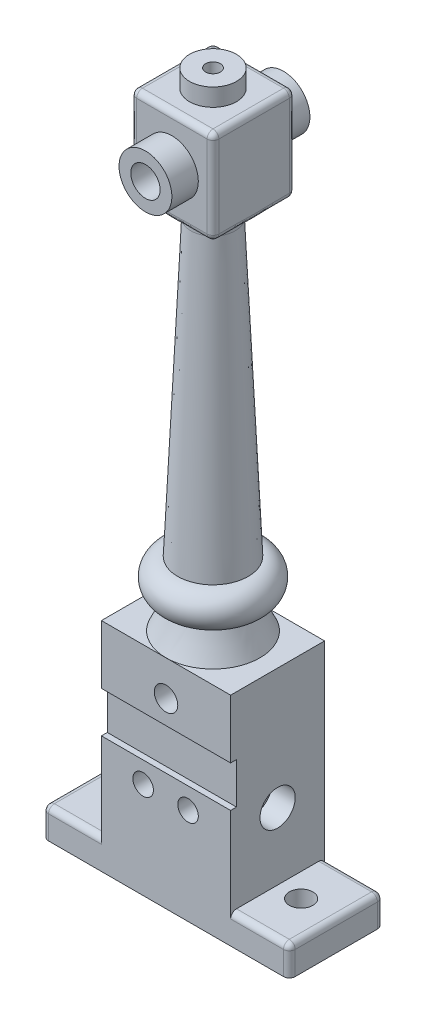
from build123d import *

# Parameters (mm, degrees)
SKETCH1_R                               = 2
BOSS_EXTRUDE1_DEPTH                     = 8
SKETCH2_W                               = 1
SKETCH2_H                               = 7
CUT_EXTRUDE1_DEPTH                      = 50.568134926
CBORE_FOR_M6_HEX_HEAD_BOLT3_D           = 3.5
CBORE_FOR_M6_HEX_HEAD_BOLT3_DEPTH       = 9
CBORE_FOR_M6_HEX_HEAD_BOLT3_CBORE_D     = 6
CBORE_FOR_M6_HEX_HEAD_BOLT3_CBORE_DEPTH = 4
SKETCH29_R                              = 1.75
CUT_EXTRUDE4_DEPTH                      = 23.5
SKETCH50_W                              = 14
SKETCH50_H                              = 14
BOSS_EXTRUDE3_DEPTH                     = 16
FILLET2_R                               = 3
BOSS_EXTRUDE4_DEPTH                     = 4.5
BOSS_EXTRUDE4_DEPTH_BACK                = 19
SKETCH52_R                              = 4.5
SKETCH54_R                              = 4
BOSS_EXTRUDE5_DEPTH                     = 3
CUT_EXTRUDE5_DEPTH                      = 125.069536954
CUT_EXTRUDE5_DEPTH_BACK                 = 125.069536954
SKETCH55_R                              = 2.5
CUT_EXTRUDE6_REACH                      = 124.413
SKETCH56_R                              = 1.25
CUT_EXTRUDE6_DIRECTION_2_DEPTH          = 123.413234579
FILLET5_R                               = 1
FILLET8_R                               = 1
SKETCH57_R                              = 2
CUT_EXTRUDE7_DEPTH                      = 118.515956471


with BuildPart() as part:
    # Sketch1 → Boss-Extrude1 (new, symmetric)
    with BuildSketch(Plane.XY):
        Polygon((-21, 0), (21, 0), (21, 5), (11, 5), (11, 37), (-11, 37), (-11, 5), (-21, 5), align=None)
        with Locations((0, 31)):
            Circle(SKETCH1_R, mode=Mode.SUBTRACT)
    extrude(amount=BOSS_EXTRUDE1_DEPTH, both=True)

    # Sketch2 → Cut-Extrude1 (cut, through all)
    with BuildSketch(Plane(origin=(11, 0, 0), x_dir=(0, 0, -1), z_dir=(1, 0, 0))):
        with Locations((-7.5, 23.5)):
            Rectangle(SKETCH2_W, SKETCH2_H)
    extrude(amount=-CUT_EXTRUDE1_DEPTH, mode=Mode.SUBTRACT)

    # CBORE for M6 Hex Head Bolt3
    with Locations(Plane(origin=(11, 0, 0), x_dir=(0, 0, -1), z_dir=(1, 0, 0))):
        with Locations((0, 16.4)):
            cbore_for_m6_hex_head_bolt3 = CounterBoreHole(CBORE_FOR_M6_HEX_HEAD_BOLT3_D / 2, CBORE_FOR_M6_HEX_HEAD_BOLT3_CBORE_D / 2, CBORE_FOR_M6_HEX_HEAD_BOLT3_CBORE_DEPTH, depth=CBORE_FOR_M6_HEX_HEAD_BOLT3_DEPTH)

    # Mirror1: CBORE for M6 Hex Head Bolt3 across plane
    add(cbore_for_m6_hex_head_bolt3.mirror(Plane(origin=(0, 0, 0), x_dir=(0, 0, 1), z_dir=(1, 0, 0))), mode=Mode.SUBTRACT)

    # Sketch29 → Cut-Extrude4 (cut)
    with BuildSketch(Plane.XY.offset(8)):
        with Locations((3.75, 16.4)):
            Circle(SKETCH29_R)
        with Locations((-3.895843616, 16.4)):
            Circle(SKETCH29_R)
    extrude(amount=-CUT_EXTRUDE4_DEPTH, mode=Mode.SUBTRACT)

    # Loft4: read off the stored shape, not the designer's step
    # Loft4: loft between two sections, ruled curve by curve
    loft4_from = [
        Edge.make_bspline([(7.297418747, 37, 3.278365391), (13.854149528, 37, -11.316472103), (-0.740687965, 37, -17.873202884), (-7.297418747, 37, -3.278365391), (-13.854149528, 37, 11.316472103), (0.740687965, 37, 17.873202884), (7.297418747, 37, 3.278365391)], [0, 0, 0, 0, 0.5, 0.5, 0.5, 1, 1, 1, 1], 3, [1, 0.333333333, 0.333333333, 1, 0.333333333, 0.333333333, 1]),
    ]
    loft4_to = [
        Edge.make_bspline([(5.968944679, 42, 0.609671566), (7.18828781, 42, -11.328217793), (-4.749601548, 42, -12.547560924), (-5.968944679, 42, -0.609671566), (-7.18828781, 42, 11.328217793), (4.749601548, 42, 12.547560924), (5.968944679, 42, 0.609671566)], [0, 0, 0, 0, 0.5, 0.5, 0.5, 1, 1, 1, 1], 3, [1, 0.333333333, 0.333333333, 1, 0.333333333, 0.333333333, 1]),
    ]
    loft4 = Solid(Shell([*[Face.make_surface_from_curves(loft4_from[k], loft4_to[k]) for k in range(1)], Face(Wire(loft4_from)), Face(Wire(loft4_to))]))
    add(loft4)

    # Sketch36 → Revolve1 (revolve)
    with BuildSketch(Plane.XY, mode=Mode.PRIVATE) as revolve1_sk:
        with BuildLine():
            Line((0, 42), (0, 48))
            Line((0, 48), (6, 48))
            ThreePointArc((6, 48), (9, 45), (6, 42))
            Line((6, 42), (0, 42))
        make_face()
    revolve(revolve1_sk.sketch.rotate(Axis((0, 42, 0), (0, 1, 0)), 90), axis=Axis((0, 42, 0), (0, 1, 0)))

    # Sketch49 → Revolve2 (revolve)
    with BuildSketch(Plane.XY, mode=Mode.PRIVATE) as revolve2_sk:
        Polygon((0, 48), (0, 101), (3.65, 101), (6, 48), align=None)
    revolve(revolve2_sk.sketch.rotate(Axis((0, 48, 0), (0, 1, 0)), 90), axis=Axis((0, 48, 0), (0, 1, 0)))

    # Sketch50 → Boss-Extrude3 (add)
    with BuildSketch(Plane(origin=(0, 101, 0), x_dir=(1, 0, 0), z_dir=(0, 1, 0))):
        Rectangle(SKETCH50_W, SKETCH50_H)
    extrude(amount=BOSS_EXTRUDE3_DEPTH)

    # Fillet2
    fillet2_edges = [part.edges().sort_by_distance(p)[0] for p in [
        (0, 101, 3.65),
    ]]
    fillet(fillet2_edges, radius=FILLET2_R)

    # Sketch52 → Boss-Extrude4 (add, two sides: drawn at the far end of the back side and taken through both)
    with BuildSketch(Plane.XY.offset(7).offset(-BOSS_EXTRUDE4_DEPTH_BACK)):
        with Locations((0, 109)):
            Circle(SKETCH52_R)
    extrude(amount=BOSS_EXTRUDE4_DEPTH + BOSS_EXTRUDE4_DEPTH_BACK)

    # Sketch54 → Boss-Extrude5 (add)
    with BuildSketch(Plane(origin=(0, 117, 0), x_dir=(1, 0, 0), z_dir=(0, 1, 0))):
        with Locations(Location((0, 0, 0), (0, 0, 270))):
            Circle(SKETCH54_R)
    extrude(amount=BOSS_EXTRUDE5_DEPTH)

    # Sketch55 → Cut-Extrude5 (cut, two sides: drawn at the far end of the back side and taken through both)
    with BuildSketch(Plane.XY.offset(11.5).offset(-CUT_EXTRUDE5_DEPTH_BACK)):
        with Locations((0, 109)):
            Circle(SKETCH55_R)
    extrude(amount=CUT_EXTRUDE5_DEPTH + CUT_EXTRUDE5_DEPTH_BACK, mode=Mode.SUBTRACT)

    # Sketch56 → Cut-Extrude6 (cut, up to next)
    with BuildSketch(Plane(origin=(0, 120, 0), x_dir=(1, 0, 0), z_dir=(0, 1, 0)), mode=Mode.PRIVATE) as cut_extrude6_sk1:
        with Locations(Location((0, 0, 0), (0, 0, 270))):
            Circle(SKETCH56_R)
    cut_extrude6_tool1 = extrude(cut_extrude6_sk1.sketch, amount=-CUT_EXTRUDE6_REACH, mode=Mode.PRIVATE) & part.part
    add(cut_extrude6_tool1.solids().sort_by_distance((0, 120, 0))[0], mode=Mode.SUBTRACT)

    # Sketch56 → Cut-Extrude6 direction 2 (cut)
    with BuildSketch(Plane(origin=(0, 120, 0), x_dir=(1, 0, 0), z_dir=(0, 1, 0))):
        with Locations(Location((0, 0, 0), (0, 0, 270))):
            Circle(SKETCH56_R)
    extrude(amount=CUT_EXTRUDE6_DIRECTION_2_DEPTH, mode=Mode.SUBTRACT)

    # Fillet5
    fillet5_edges = [part.edges().sort_by_distance(p)[0] for p in [
        (7, 101, 0),
        (7, 109, 7),
        (0, 101, -7),
        (7, 109, -7),
        (-7, 101, 0),
        (-7, 109, -7),
        (0, 101, 7),
        (-7, 109, 7),
        (7, 117, 0),
        (0, 117, -7),
        (-7, 117, 0),
        (0, 117, 7),
    ]]
    fillet(fillet5_edges, radius=FILLET5_R)

    # Fillet8
    fillet8_edges = [part.edges().sort_by_distance(p)[0] for p in [
        (16, 5, -8),
        (21, 2.5, -8),
        (-21, 5, 0),
        (21, 5, 0),
        (-16, 5, 8),
        (-21, 2.5, 8),
        (21, 2.5, 8),
        (16, 5, 8),
        (-21, 2.5, -8),
        (-16, 5, -8),
    ]]
    fillet(fillet8_edges, radius=FILLET8_R)

    # Sketch57 → Cut-Extrude7 (cut, through all)
    with BuildSketch(Plane(origin=(0, 5, 0), x_dir=(1, 0, 0), z_dir=(0, 1, 0))):
        with Locations(Location((-15, 0, 0), (0, 0, 180))):
            Circle(SKETCH57_R)
        with Locations(Location((15, 0, 0), (0, 0, 180))):
            Circle(SKETCH57_R)
    extrude(amount=-CUT_EXTRUDE7_DEPTH, mode=Mode.SUBTRACT)


solid = part.part
